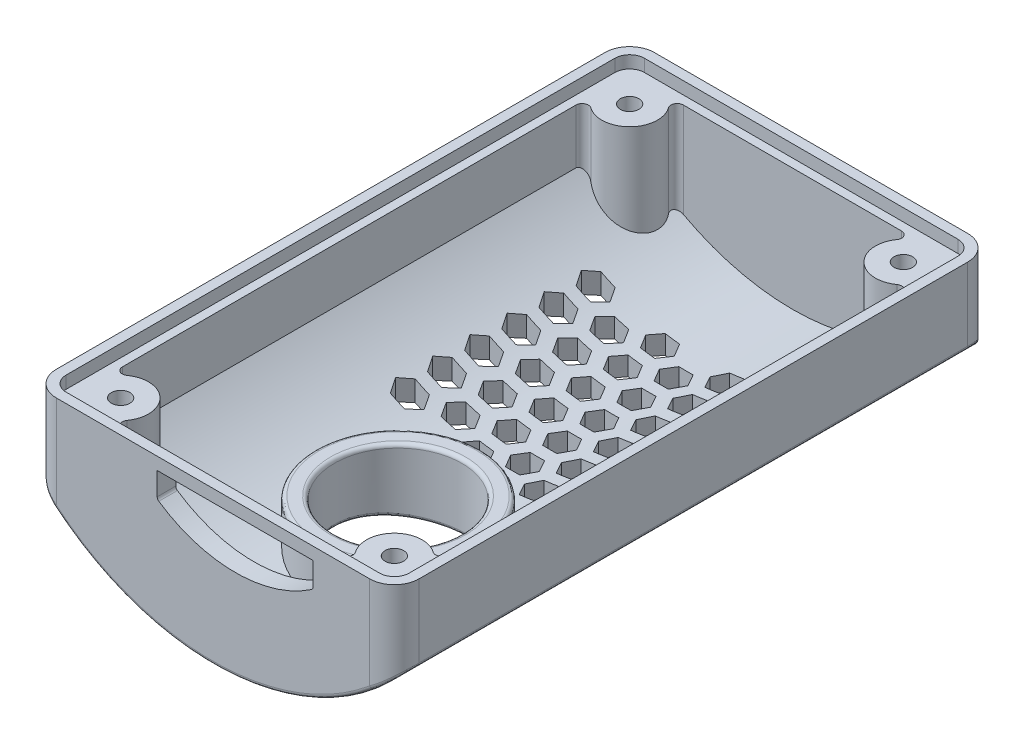
from build123d import *

# Parameters (mm, degrees)
SKETCH_1_W           = 29.3
SKETCH_1_H           = 48.3
EXTRUDE_1_DEPTH      = 5
SKETCH_2_W           = 26.3
SKETCH_2_H           = 45.3
CUT_EXTRUDE_1_DEPTH  = 4
EXTRUDE_6_DEPTH      = 48.3
CUT_EXTRUDE_7_DEPTH  = 45.3
EXTRUDE_2_REACH      = 32.454
EXTRUDE_2_END_RADIUS = 18.5
SKETCH_15_R          = 0.75
CUT_EXTRUDE_8_DEPTH  = 4
CUT_EXTRUDE_2_REACH  = 52.875
CUT_EXTRUDE_START    = -12
CUT_EXTRUDE_4_DEPTH  = 4.428034454
EXTRUDE_3_DEPTH      = 1
EXTRUDE_4_REACH      = 32.454
EXTRUDE_4_END_RADIUS = 18.5
SKETCH_8_R           = 6.65
SKETCH_8_R_2         = 5.15
CUT_EXTRUDE_5_REACH  = 32.454
SKETCH_9_R           = 5.15
SKETCH_16_R          = 6.65
CUT_EXTRUDE_9_DEPTH  = 6
FILLET_1_R           = 0.5
FILLET_2_R           = 2
FILLET_3_R           = 0.3
FILLET_4_R           = 0.3
FILLET_5_R           = 1.2
FILLET_6_R           = 0.3


with BuildPart() as part:
    # 草图1 → 凸台-拉伸1 (new body)
    with BuildSketch(Plane(origin=(0, 0, 0), x_dir=(1, 0, 0), z_dir=(0, 1, 0))):
        Rectangle(SKETCH_1_W, SKETCH_1_H)
    extrude(amount=EXTRUDE_1_DEPTH)

    # 草图2 → 切除-拉伸1 (cut)
    with BuildSketch(Plane(origin=(0, 5, 0), x_dir=(1, 0, 0), z_dir=(0, 1, 0))):
        Rectangle(SKETCH_2_W, SKETCH_2_H)
    extrude(amount=-CUT_EXTRUDE_1_DEPTH, mode=Mode.SUBTRACT)

    # 草图12 → 凸台-拉伸6 (add)
    with BuildSketch(Plane.XY.offset(24.15)):
        with BuildLine():
            Line((-14.65, 0), (14.65, 0))
            ThreePointArc((14.65, 0), (0, -6.384659387), (-14.65, 0))
        make_face()
    extrude(amount=-EXTRUDE_6_DEPTH)

    # 草图13 → 切除-拉伸7 (cut)
    with BuildSketch(Plane(origin=(0, 0, 22.65), x_dir=(-1, 0, 0), z_dir=(0, 0, -1))):
        with BuildLine():
            Line((13.15, 1.021150546), (-13.15, 1.021150546))
            Line((-13.15, 1.021150546), (-13.15, 0.602750555))
            ThreePointArc((-13.15, 0.602750555), (0, -4.884659387), (13.15, 0.602750555))
            Line((13.15, 0.602750555), (13.15, 1.021150546))
        make_face()
    extrude(amount=CUT_EXTRUDE_7_DEPTH, mode=Mode.SUBTRACT)

    # 凸台-拉伸2: up to this cylinder (the profile starts inside it)
    extrude_2_end = Plane(origin=(0, 13.615340613, 0), z_dir=(0, 0, 1)) * Cylinder(EXTRUDE_2_END_RADIUS, 144.09241, mode=Mode.PRIVATE)
    # 草图3 → 凸台-拉伸2 (add, up to the surface)
    with BuildSketch(Plane(origin=(0, 5, 0), x_dir=(1, 0, 0), z_dir=(0, 1, 0)), mode=Mode.PRIVATE) as extrude_2_sk1:
        with BuildLine():
            Line((-13.15, 22.65), (-10.242225279, 22.65))
            ThreePointArc((-10.242225279, 22.65), (-9.459009742, 18.959009742), (-13.15, 19.742225279))
            Line((-13.15, 19.742225279), (-13.15, 22.65))
        make_face()
    extrude_2_tool1 = extrude(extrude_2_sk1.sketch, amount=-EXTRUDE_2_REACH, mode=Mode.PRIVATE) & extrude_2_end
    add(extrude_2_tool1.solids().sort_by_distance((-11.092205, 5, -20.592205))[0])
    # 草图3 → 凸台-拉伸2 (add, up to the surface)
    with BuildSketch(Plane(origin=(0, 5, 0), x_dir=(1, 0, 0), z_dir=(0, 1, 0)), mode=Mode.PRIVATE) as extrude_2_sk2:
        with BuildLine():
            Line((13.15, -19.742225279), (13.15, -22.65))
            Line((13.15, -22.65), (10.242225279, -22.65))
            ThreePointArc((10.242225279, -22.65), (9.459009742, -18.959009742), (13.15, -19.742225279))
        make_face()
    extrude_2_tool2 = extrude(extrude_2_sk2.sketch, amount=-EXTRUDE_2_REACH, mode=Mode.PRIVATE) & extrude_2_end
    add(extrude_2_tool2.solids().sort_by_distance((11.092205, 5, 20.592205))[0])
    # 草图3 → 凸台-拉伸2 (add, up to the surface)
    with BuildSketch(Plane(origin=(0, 5, 0), x_dir=(1, 0, 0), z_dir=(0, 1, 0)), mode=Mode.PRIVATE) as extrude_2_sk3:
        with BuildLine():
            Line((13.15, 22.65), (10.242225279, 22.65))
            ThreePointArc((10.242225279, 22.65), (9.459009742, 18.959009742), (13.15, 19.742225279))
            Line((13.15, 19.742225279), (13.15, 22.65))
        make_face()
    extrude_2_tool3 = extrude(extrude_2_sk3.sketch, amount=-EXTRUDE_2_REACH, mode=Mode.PRIVATE) & extrude_2_end
    add(extrude_2_tool3.solids().sort_by_distance((11.092205, 5, -20.592205))[0])
    # 草图3 → 凸台-拉伸2 (add, up to the surface)
    with BuildSketch(Plane(origin=(0, 5, 0), x_dir=(1, 0, 0), z_dir=(0, 1, 0)), mode=Mode.PRIVATE) as extrude_2_sk4:
        with BuildLine():
            Line((-13.15, -19.742225279), (-13.15, -22.65))
            Line((-13.15, -22.65), (-10.242225279, -22.65))
            ThreePointArc((-10.242225279, -22.65), (-9.459009742, -18.959009742), (-13.15, -19.742225279))
        make_face()
    extrude_2_tool4 = extrude(extrude_2_sk4.sketch, amount=-EXTRUDE_2_REACH, mode=Mode.PRIVATE) & extrude_2_end
    add(extrude_2_tool4.solids().sort_by_distance((-11.092205, 5, 20.592205))[0])

    # 草图15 → 切除-拉伸8 (cut)
    with BuildSketch(Plane(origin=(0, 5, 0), x_dir=(1, 0, 0), z_dir=(0, 1, 0))):
        with Locations(Location((-11.05, 20.55, 0), (0, 0, 270))):
            Circle(SKETCH_15_R)
        with Locations(Location((11.05, 20.55, 0), (0, 0, 270))):
            Circle(SKETCH_15_R)
        with Locations(Location((11.05, -20.55, 0), (0, 0, 270))):
            Circle(SKETCH_15_R)
        with Locations(Location((-11.05, -20.55, 0), (0, 0, 270))):
            Circle(SKETCH_15_R)
    extrude(amount=-CUT_EXTRUDE_8_DEPTH, mode=Mode.SUBTRACT)

    # 草图4 → 切除-拉伸2 (cut, up to next)
    with BuildSketch(Plane.XY.offset(24.15), mode=Mode.PRIVATE) as cut_extrude_2_sk1:
        with BuildLine():
            Line((-4.5, 5), (8.1, 5))
            Line((8.1, 5), (8.1, 3))
            ThreePointArc((8.1, 3), (1.8, 1.017205776), (-4.5, 3))
            Line((-4.5, 3), (-4.5, 5))
        make_face()
    cut_extrude_2_tool1 = extrude(cut_extrude_2_sk1.sketch, amount=-CUT_EXTRUDE_2_REACH, mode=Mode.PRIVATE) & part.part
    add(cut_extrude_2_tool1.solids().sort_by_distance((1.8, 3.275536, 24.15))[0], mode=Mode.SUBTRACT)

    # 切除-拉伸4: read off the stored shape, not the designer's step
    # 切除-拉伸4 outline → 切除-拉伸4 (cut)
    with BuildSketch(Plane(origin=(0, 5, 0), x_dir=(1, 0, 0), z_dir=(0, 1, 0)).offset(CUT_EXTRUDE_START)):
        Polygon((-5.777350269, 12.05), (-4.622649731, 12.05), (-4.045299462, 13.05), (-4.622649731, 14.05), (-5.777350269, 14.05), (-6.354700538, 13.05), align=None)
        Polygon((-8.375426481, 7.55), (-7.220725942, 7.55), (-6.643375673, 8.55), (-7.220725942, 9.55), (-8.375426481, 9.55), (-8.95277675, 8.55), align=None)
        Polygon((4.045299462, 13.05), (4.622649731, 12.05), (5.777350269, 12.05), (6.354700538, 13.05), (5.777350269, 14.05), (4.622649731, 14.05), align=None)
        Polygon((-1.154700538, 13.05), (-0.577350269, 12.05), (0.577350269, 12.05), (1.154700538, 13.05), (0.577350269, 14.05), (-0.577350269, 14.05), align=None)
        Polygon((-0.577350269, 0.05), (0.577350269, 0.05), (1.154700538, 1.05), (0.577350269, 2.05), (-0.577350269, 2.05), (-1.154700538, 1.05), align=None)
        Polygon((4.045299462, 1.05), (4.622649731, 0.05), (5.777350269, 0.05), (6.354700538, 1.05), (5.777350269, 2.05), (4.622649731, 2.05), align=None)
        Polygon((-6.354700538, 1.05), (-5.777350269, 0.05), (-4.622649731, 0.05), (-4.045299462, 1.05), (-4.622649731, 2.05), (-5.777350269, 2.05), align=None)
        Polygon((-3.175426481, 6.55), (-3.75277675, 5.55), (-3.175426481, 4.55), (-2.020725942, 4.55), (-1.443375673, 5.55), (-2.020725942, 6.55), align=None)
        Polygon((2.024573519, 6.55), (1.44722325, 5.55), (2.024573519, 4.55), (3.179274058, 4.55), (3.756624327, 5.55), (3.179274058, 6.55), align=None)
        Polygon((-5.777350269, 9.05), (-4.622649731, 9.05), (-4.045299462, 10.05), (-4.622649731, 11.05), (-5.777350269, 11.05), (-6.354700538, 10.05), align=None)
        Polygon((-8.375426481, 4.55), (-7.220725942, 4.55), (-6.643375673, 5.55), (-7.220725942, 6.55), (-8.375426481, 6.55), (-8.95277675, 5.55), align=None)
        Polygon((-1.154700538, 10.05), (-0.577350269, 9.05), (0.577350269, 9.05), (1.154700538, 10.05), (0.577350269, 11.05), (-0.577350269, 11.05), align=None)
        Polygon((4.045299462, 10.05), (4.622649731, 9.05), (5.777350269, 9.05), (6.354700538, 10.05), (5.777350269, 11.05), (4.622649731, 11.05), align=None)
        Polygon((-8.375426481, 15.55), (-8.95277675, 14.55), (-8.375426481, 13.55), (-7.220725942, 13.55), (-6.643375673, 14.55), (-7.220725942, 15.55), align=None)
        Polygon((-5.777350269, 6.05), (-4.622649731, 6.05), (-4.045299462, 7.05), (-4.622649731, 8.05), (-5.777350269, 8.05), (-6.354700538, 7.05), align=None)
        Polygon((-8.375426481, 1.55), (-7.220725942, 1.55), (-6.643375673, 2.55), (-7.220725942, 3.55), (-8.375426481, 3.55), (-8.95277675, 2.55), align=None)
        Polygon((4.045299462, 7.05), (4.622649731, 6.05), (5.777350269, 6.05), (6.354700538, 7.05), (5.777350269, 8.05), (4.622649731, 8.05), align=None)
        Polygon((-1.154700538, 7.05), (-0.577350269, 6.05), (0.577350269, 6.05), (1.154700538, 7.05), (0.577350269, 8.05), (-0.577350269, 8.05), align=None)
        Polygon((-8.375426481, 12.55), (-8.95277675, 11.55), (-8.375426481, 10.55), (-7.220725942, 10.55), (-6.643375673, 11.55), (-7.220725942, 12.55), align=None)
        Polygon((-5.777350269, 3.05), (-4.622649731, 3.05), (-4.045299462, 4.05), (-4.622649731, 5.05), (-5.777350269, 5.05), (-6.354700538, 4.05), align=None)
        Polygon((-8.375426481, -1.45), (-7.220725942, -1.45), (-6.643375673, -0.45), (-7.220725942, 0.55), (-8.375426481, 0.55), (-8.95277675, -0.45), align=None)
        Polygon((4.045299462, 4.05), (4.622649731, 3.05), (5.777350269, 3.05), (6.354700538, 4.05), (5.777350269, 5.05), (4.622649731, 5.05), align=None)
        Polygon((-1.154700538, 4.05), (-0.577350269, 3.05), (0.577350269, 3.05), (1.154700538, 4.05), (0.577350269, 5.05), (-0.577350269, 5.05), align=None)
        Polygon((1.44722325, 14.55), (2.024573519, 13.55), (3.179274058, 13.55), (3.756624327, 14.55), (3.179274058, 15.55), (2.024573519, 15.55), align=None)
        Polygon((6.64722325, 14.55), (7.224573519, 13.55), (8.379274058, 13.55), (8.956624327, 14.55), (8.379274058, 15.55), (7.224573519, 15.55), align=None)
        Polygon((-3.75277675, 14.55), (-3.175426481, 13.55), (-2.020725942, 13.55), (-1.443375673, 14.55), (-2.020725942, 15.55), (-3.175426481, 15.55), align=None)
        Polygon((-3.75277675, 11.55), (-3.175426481, 10.55), (-2.020725942, 10.55), (-1.443375673, 11.55), (-2.020725942, 12.55), (-3.175426481, 12.55), align=None)
        Polygon((1.44722325, 11.55), (2.024573519, 10.55), (3.179274058, 10.55), (3.756624327, 11.55), (3.179274058, 12.55), (2.024573519, 12.55), align=None)
        Polygon((6.64722325, 11.55), (7.224573519, 10.55), (8.379274058, 10.55), (8.956624327, 11.55), (8.379274058, 12.55), (7.224573519, 12.55), align=None)
        Polygon((2.024573519, 7.55), (3.179274058, 7.55), (3.756624327, 8.55), (3.179274058, 9.55), (2.024573519, 9.55), (1.44722325, 8.55), align=None)
        Polygon((-3.175426481, 7.55), (-2.020725942, 7.55), (-1.443375673, 8.55), (-2.020725942, 9.55), (-3.175426481, 9.55), (-3.75277675, 8.55), align=None)
        Polygon((2.024573519, -1.45), (3.179274058, -1.45), (3.756624327, -0.45), (3.179274058, 0.55), (2.024573519, 0.55), (1.44722325, -0.45), align=None)
        Polygon((-3.175426481, -1.45), (-2.020725942, -1.45), (-1.443375673, -0.45), (-2.020725942, 0.55), (-3.175426481, 0.55), (-3.75277675, -0.45), align=None)
        Polygon((2.024573519, 1.55), (3.179274058, 1.55), (3.756624327, 2.55), (3.179274058, 3.55), (2.024573519, 3.55), (1.44722325, 2.55), align=None)
        Polygon((-3.175426481, 1.55), (-2.020725942, 1.55), (-1.443375673, 2.55), (-2.020725942, 3.55), (-3.175426481, 3.55), (-3.75277675, 2.55), align=None)
        Polygon((6.64722325, -0.45), (7.224573519, -1.45), (8.379274058, -1.45), (8.956624327, -0.45), (8.379274058, 0.55), (7.224573519, 0.55), align=None)
        Polygon((6.64722325, 2.55), (7.224573519, 1.55), (8.379274058, 1.55), (8.956624327, 2.55), (8.379274058, 3.55), (7.224573519, 3.55), align=None)
        Polygon((6.64722325, 5.55), (7.224573519, 4.55), (8.379274058, 4.55), (8.956624327, 5.55), (8.379274058, 6.55), (7.224573519, 6.55), align=None)
        Polygon((6.64722325, 8.55), (7.224573519, 7.55), (8.379274058, 7.55), (8.956624327, 8.55), (8.379274058, 9.55), (7.224573519, 9.55), align=None)
    extrude(amount=CUT_EXTRUDE_4_DEPTH, mode=Mode.SUBTRACT)

    # 草图7 → 凸台-拉伸3 (add)
    with BuildSketch(Plane(origin=(0, 5, 0), x_dir=(1, 0, 0), z_dir=(0, 1, 0))):
        Polygon((-14.65, 24.15), (14.65, 24.15), (14.65, -24.15), (8.1, -24.15), (-4.5, -24.15), (-14.65, -24.15), align=None)
        Polygon((-13.85, 23.35), (13.85, 23.35), (13.85, -23.35), (8.1, -23.35), (-4.5, -23.35), (-13.85, -23.35), align=None, mode=Mode.SUBTRACT)
    extrude(amount=EXTRUDE_3_DEPTH)

    # 凸台-拉伸4: up to this cylinder (the profile starts inside it)
    extrude_4_end = Plane(origin=(0, 13.615340613, 3.73809), z_dir=(0, 0, 1)) * Cylinder(EXTRUDE_4_END_RADIUS, 102.908, mode=Mode.PRIVATE)
    # 草图8 → 凸台-拉伸4 (add, up to the surface)
    with BuildSketch(Plane(origin=(0, 5, 0), x_dir=(1, 0, 0), z_dir=(0, 1, 0)), mode=Mode.PRIVATE) as extrude_4_sk1:
        with Locations(Location((1, -10.2, 0), (0, 0, 270))):
            Circle(SKETCH_8_R)
        with Locations(Location((1, -10.2, 0), (0, 0, 270))):
            Circle(SKETCH_8_R_2, mode=Mode.SUBTRACT)
    extrude_4_tool1 = extrude(extrude_4_sk1.sketch, amount=-EXTRUDE_4_REACH, mode=Mode.PRIVATE) & extrude_4_end
    add(extrude_4_tool1.solids().sort_by_distance((1, 5, 3.73809))[0])

    # 草图9 → 切除-拉伸5 (cut, up to next)
    with BuildSketch(Plane(origin=(0, 5, 0), x_dir=(1, 0, 0), z_dir=(0, 1, 0)), mode=Mode.PRIVATE) as cut_extrude_5_sk1:
        with Locations(Location((1, -10.2, 0), (0, 0, 270))):
            Circle(SKETCH_9_R)
    cut_extrude_5_tool1 = extrude(cut_extrude_5_sk1.sketch, amount=-CUT_EXTRUDE_5_REACH, mode=Mode.PRIVATE) & part.part
    add(cut_extrude_5_tool1.solids().sort_by_distance((1, 5, 10.2))[0], mode=Mode.SUBTRACT)

    # 草图16 → 切除-拉伸9 (cut)
    with BuildSketch(Plane(origin=(0, 5, 0), x_dir=(1, 0, 0), z_dir=(0, 1, 0))):
        with Locations(Location((1, -10.2, 0), (0, 0, 270))):
            Circle(SKETCH_16_R)
    extrude(amount=-CUT_EXTRUDE_9_DEPTH, mode=Mode.SUBTRACT)

    # 圆角1
    fillet_1_edges = [part.edges().sort_by_distance(p)[0] for p in [
        (-13.15, 2.801375278, 19.742225279),
        (-10.242225279, 1.604638089, 22.65),
        (10.242225279, 1.604638089, 22.65),
        (13.15, 2.801375278, 19.742225279),
        (13.15, 2.801375278, -19.742225279),
        (10.242225279, 1.604638089, -22.65),
        (-13.15, 2.801375278, -19.742225279),
        (-10.242225279, 1.604638089, -22.65),
    ]]
    fillet(fillet_1_edges, radius=FILLET_1_R)

    # 圆角2
    fillet_2_edges = [part.edges().sort_by_distance(p)[0] for p in [
        (14.65, 3, 24.15),
        (-14.65, 3, 24.15),
        (-14.65, 3, -24.15),
        (14.65, 3, -24.15),
    ]]
    fillet(fillet_2_edges, radius=FILLET_2_R)

    # 圆角3
    fillet_3_edges = [part.edges().sort_by_distance(p)[0] for p in [
        (-4.5, 3, 23.4),
        (8.1, 3, 23.4),
    ]]
    fillet(fillet_3_edges, radius=FILLET_3_R)

    # 圆角4
    fillet_4_edges = [part.edges().sort_by_distance(p)[0] for p in [
        (14.65, 0, 0),
        (0, -6.384659387, -24.15),
        (0, -6.384659387, 24.15),
        (-14.65, 0, 0),
        (13.971968939, -0.694938361, -23.650799229),
        (-13.971968941, -0.69493836, -23.650799231),
        (-13.971968939, -0.694938361, 23.650799229),
        (13.971968912, -0.694938388, 23.650799252),
    ]]
    fillet(fillet_4_edges, radius=FILLET_4_R)

    # 圆角5
    fillet_5_edges = [part.edges().sort_by_distance(p)[0] for p in [
        (-13.85, 5.5, 23.35),
        (13.85, 5.5, 23.35),
        (13.85, 5.5, -23.35),
        (-13.85, 5.5, -23.35),
    ]]
    fillet(fillet_5_edges, radius=FILLET_5_R)

    # 圆角6
    fillet_6_edges = [part.edges().sort_by_distance(p)[0] for p in [
        (1.046571868, -6.357257788, 5.050210581),
        (1, -1, 3.55),
        (1, -1, 5.05),
    ]]
    fillet(fillet_6_edges, radius=FILLET_6_R)


solid = part.part
